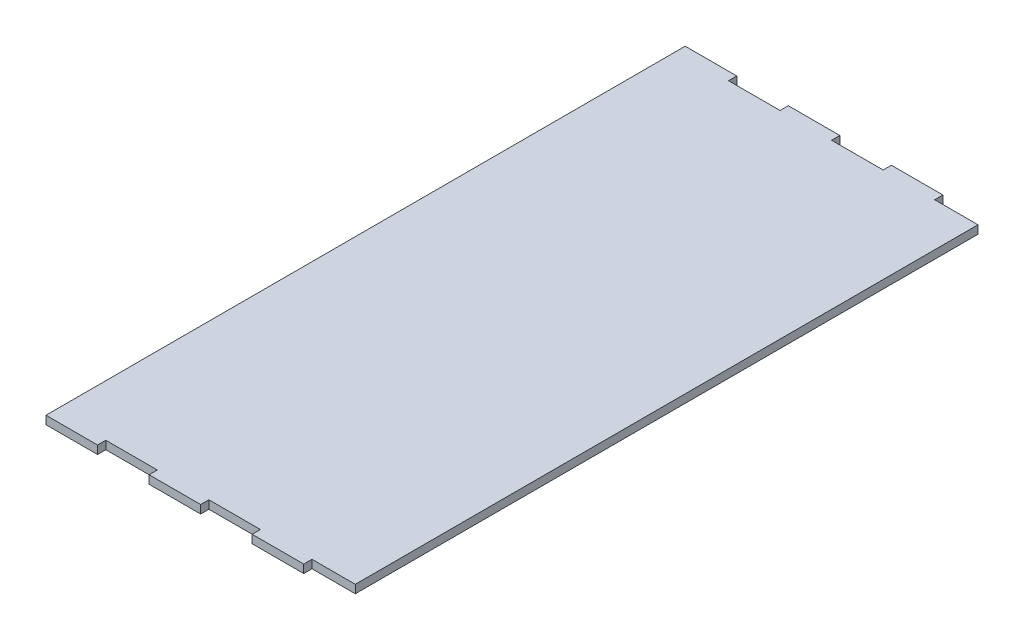
from build123d import *

# Parameters (mm, degrees)
SALIENTE_EXTRUIR1_DEPTH = 4
CORTAR_EXTRUIR1_DEPTH   = 10


with BuildPart() as part:
    # Croquis1 → Saliente-Extruir1 (new body)
    with BuildSketch(Plane(origin=(0, 0, 0), x_dir=(1, 0, 0), z_dir=(0, 1, 0))):
        Polygon((-50, 155), (-100, 155), (-150, 155), (-196, 155), (-196, -155), (-150, -155), (-100, -155), (-50, -155), align=None)
    extrude(amount=SALIENTE_EXTRUIR1_DEPTH)

    # Croquis2 → Cortar-Extruir1 (cut)
    with BuildSketch(Plane(origin=(0, 4, 0), x_dir=(1, 0, 0), z_dir=(0, 1, 0))):
        Polygon((-196, 155), (-171, 155), (-171, 151), (-146, 151), (-146, 155), (-121, 155), (-121, 151), (-96, 151), (-96, 155), (-71, 155), (-71, 151), (-46, 151), (-46, 195.594433327), (-196, 195.594433327), align=None)
        Polygon((-196, -195.594433327), (-196, -155), (-171, -155), (-171, -151), (-146, -151), (-146, -155), (-121, -155), (-121, -151), (-96, -151), (-96, -155), (-71, -155), (-71, -151), (-46, -151), (-46, -195.594433327), align=None)
    extrude(amount=-CORTAR_EXTRUIR1_DEPTH, mode=Mode.SUBTRACT)


solid = part.part
